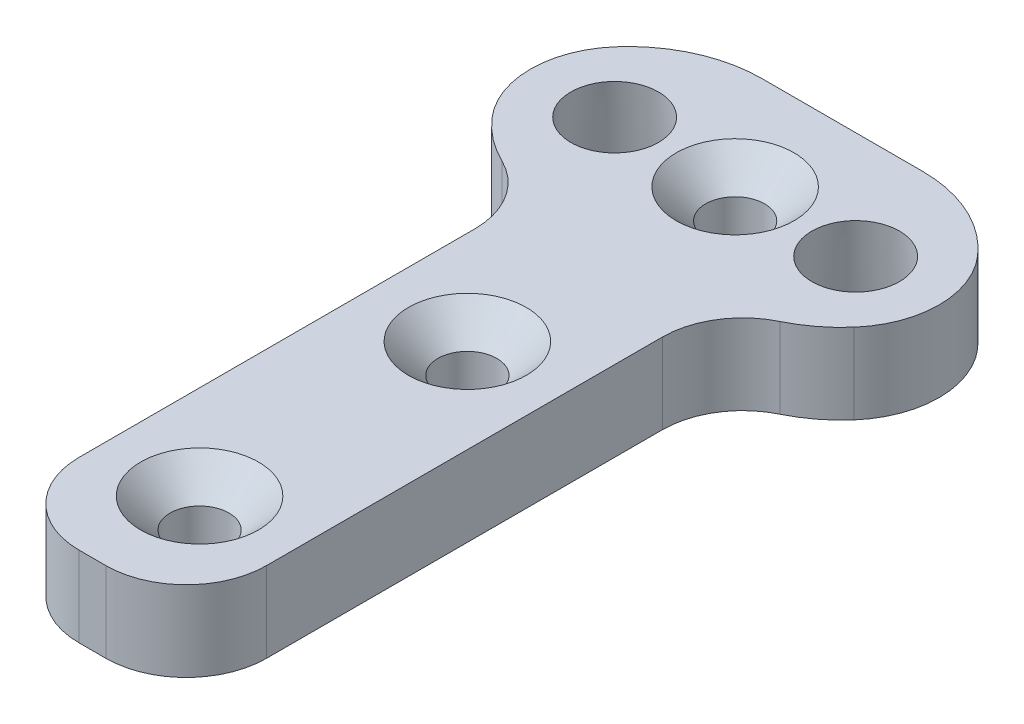
from build123d import *

# Parameters (mm, degrees)
BOSS_EXTRUDE1_DEPTH                                 = 3
CSK_FOR_M2_COUNTERSUNK_FLAT_HEAD_SCREW3_D           = 2.2
CSK_FOR_M2_COUNTERSUNK_FLAT_HEAD_SCREW3_DEPTH       = 3
CSK_FOR_M2_COUNTERSUNK_FLAT_HEAD_SCREW3_CSINK_D     = 4.4
CSK_FOR_M2_COUNTERSUNK_FLAT_HEAD_SCREW3_CSINK_ANGLE = 90
CSK_FOR_M2_COUNTERSUNK_FLAT_HEAD_SCREW3_TIP         = 0.660946681
FILLET1_R                                           = 5
FILLET2_R                                           = 3.5
FILLET3_R                                           = 3
CSK_FOR_M2_COUNTERSUNK_FLAT_HEAD_SCR_2_COUNT        = 2
CSK_FOR_M2_COUNTERSUNK_FLAT_HEAD_SCR_2_PITCH        = 9


with BuildPart() as part:
    # Sketch1 → Boss-Extrude1 (new body)
    with BuildSketch(Plane(origin=(0, 0, 0), x_dir=(1, 0, 0), z_dir=(0, 1, 0))):
        Polygon((3.5, 6), (8, 6), (8, 14), (-8, 14), (-8, 6), (-3.5, 6), (-3.5, -14), (3.5, -14), align=None)
    extrude(amount=BOSS_EXTRUDE1_DEPTH)

    # CSK for M2 Countersunk Flat Head Screw3
    with Locations(Plane(origin=(0, 3, 0), x_dir=(1, 0, 0), z_dir=(0, 1, 0))):
        with Locations((0, 10), (0, 0), (0, -10)):
            CounterSinkHole(CSK_FOR_M2_COUNTERSUNK_FLAT_HEAD_SCREW3_D / 2, CSK_FOR_M2_COUNTERSUNK_FLAT_HEAD_SCREW3_CSINK_D / 2, depth=CSK_FOR_M2_COUNTERSUNK_FLAT_HEAD_SCREW3_DEPTH, counter_sink_angle=CSK_FOR_M2_COUNTERSUNK_FLAT_HEAD_SCREW3_CSINK_ANGLE)
            with Locations((0, 0, -(CSK_FOR_M2_COUNTERSUNK_FLAT_HEAD_SCREW3_DEPTH + CSK_FOR_M2_COUNTERSUNK_FLAT_HEAD_SCREW3_TIP / 2))):  # 118° drill point
                Cone(0, CSK_FOR_M2_COUNTERSUNK_FLAT_HEAD_SCREW3_D / 2, CSK_FOR_M2_COUNTERSUNK_FLAT_HEAD_SCREW3_TIP, mode=Mode.SUBTRACT)

    # Fillet1
    # the kernel refuses this fillet: 5 mm, written as the material it takes off along each edge
    with BuildSketch(Plane(origin=(-8, -12.437342964, -6), x_dir=(1, 0, 0), z_dir=(0, 1, 0))) as fillet1_piece_1:
        with BuildLine():
            CenterArc((5, 4.974937186), FILLET1_R, 180, 84.260829523)
            Line((0, 4.974937186), (-0.1, 4.974937186))
            Line((-0.1, 4.974937186), (-0.1, 0))
            Line((-0.1, 0), (0, -0.1))
            ThreePointArc((0, -0.1), (2.25, -0.1), (4.49, -0.099498744))
            Line((4.49, -0.099498744), (4.5, 0))
        make_face()
    extrude(amount=27.874685928, mode=Mode.SUBTRACT)
    with BuildSketch(Plane(origin=(-8, -12.5, -14), x_dir=(0, 0, 1), z_dir=(0, 1, 0)), Plane(origin=(8, -12.5, -14), x_dir=(-1, 0, 0), z_dir=(0, 1, 0))) as fillet1_piece_2:
        with BuildLine():
            CenterArc((FILLET1_R, FILLET1_R), FILLET1_R, 180, 90)
            Line((0, FILLET1_R), (-FILLET1_R * 0.02, FILLET1_R))
            Line((-FILLET1_R * 0.02, FILLET1_R), (-FILLET1_R * 0.02, -FILLET1_R * 0.02))
            Line((-FILLET1_R * 0.02, -FILLET1_R * 0.02), (FILLET1_R, -FILLET1_R * 0.02))
            Line((FILLET1_R, -FILLET1_R * 0.02), (FILLET1_R, 0))
        make_face()
    extrude(amount=28, mode=Mode.SUBTRACT)
    with BuildSketch(Plane(origin=(8, -12.437342964, -6), x_dir=(-1, 0, 0), z_dir=(0, 1, 0))) as fillet1_piece_3:
        with BuildLine():
            CenterArc((5, -4.974937186), FILLET1_R, 95.739170477, 84.260829523)
            Line((0, -4.974937186), (-0.1, -4.974937186))
            Line((-0.1, -4.974937186), (-0.1, 0))
            Line((-0.1, 0), (0, 0.1))
            ThreePointArc((0, 0.1), (2.25, 0.1), (4.49, 0.099498744))
            Line((4.49, 0.099498744), (4.5, 0))
        make_face()
    extrude(amount=27.874685928, mode=Mode.SUBTRACT)

    # Fillet2
    fillet2_edges = [part.edges().sort_by_distance(p)[0] for p in [
        (-7.901520762, 1.5, -9.987468593),
        (7.901520762, 1.5, -9.987468593),
    ]]
    fillet(fillet2_edges, radius=FILLET2_R)

    # Fillet3
    fillet3_edges = [part.edges().sort_by_distance(p)[0] for p in [
        (3.5, 1.5, -6),
        (3.5, 1.5, 14),
        (-3.5, 1.5, 14),
        (-3.5, 1.5, -6),
    ]]
    fillet(fillet3_edges, radius=FILLET3_R)

    # Sketch8 → CSK for M2 Countersunk Flat Head Screw2 (revolve, cut)
    with BuildSketch(Plane(origin=(-4.5, 0, -10), x_dir=(0, 0, -1), z_dir=(1, 0, 0))):
        Polygon((0, 0), (0, 3), (1.6, 3), (1.6, 3.375254051), (1.925, 0), align=None)
    csk_for_m2_countersunk_flat_head_screw2 = revolve(axis=Axis((-4.5, -6.35, -10), (0, 1, 0)), mode=Mode.SUBTRACT)

    # CSK for M2 Countersunk Flat Head Scr 2: CSK for M2 Countersunk Flat Head Screw2 ×2
    with Locations(*[(i * CSK_FOR_M2_COUNTERSUNK_FLAT_HEAD_SCR_2_PITCH, 0, 0) for i in range(1, CSK_FOR_M2_COUNTERSUNK_FLAT_HEAD_SCR_2_COUNT)]):
        add(csk_for_m2_countersunk_flat_head_screw2, mode=Mode.SUBTRACT)


solid = part.part
